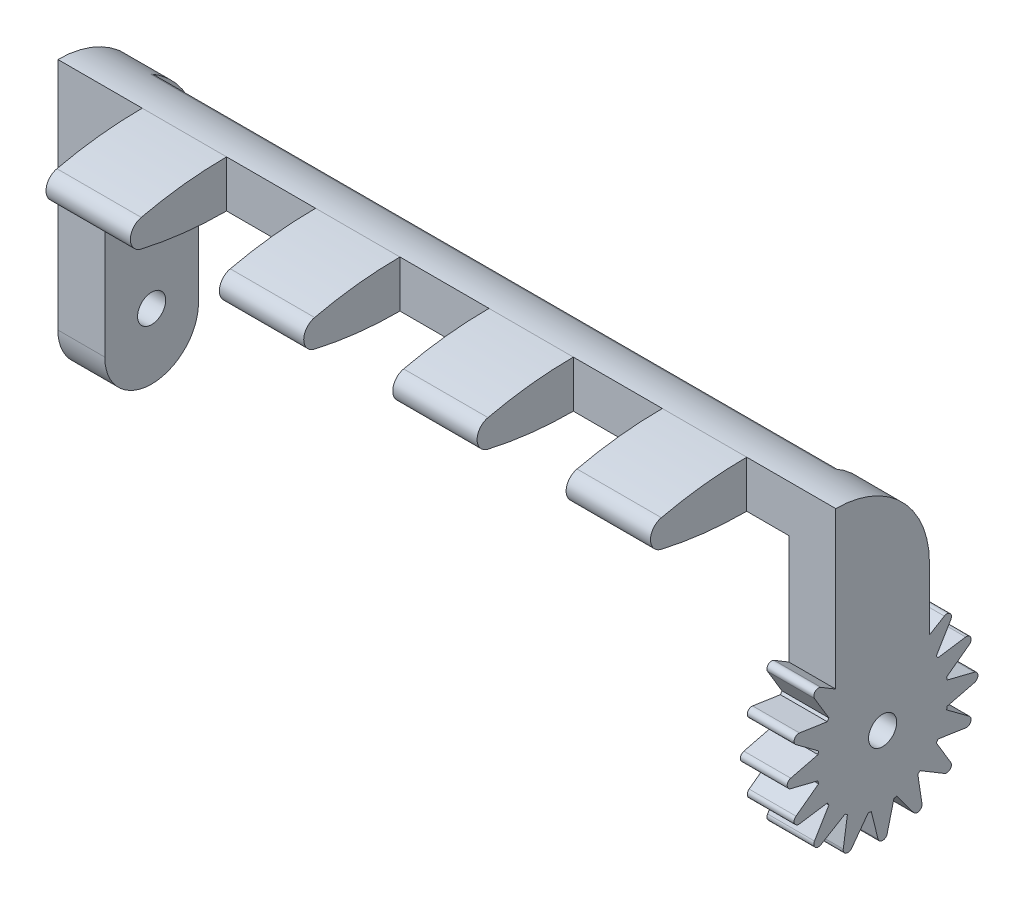
from build123d import *

# Parameters (mm, degrees)
BOSS_EXTRU_1_DEPTH               = 10
BOSS_EXTRU_2_START               = -9
BOSS_EXTRU_2_DEPTH               = 9
CONG_1_R                         = 1.5
R_P_TITION_LIN_AIRE1_COUNT       = 4
R_P_TITION_LIN_AIRE1_PITCH       = 18.5
CONG_1_OF_R_P_TITION_LIN_AIRE1_R = 1.5
ENL_V_MAT_EXTRU_1_DEPTH          = 82.974649073
ENL_V_MAT_EXTRU_1_DEPTH_BACK     = 82.974649073
ESQUISSE4_R                      = 1.5
CONG_2_RADIUS                    = 5
CONG_2_LENGTH                    = 5
CONG_3_RADIUS                    = 5
CONG_3_LENGTH                    = 5
CONG_4_R                         = 10
BOSS_EXTRU_3_START               = 73
ESQUISSE5_R                      = 1.5
BOSS_EXTRU_3_DEPTH               = 5
CONG_7_R                         = 2


with BuildPart() as part:
    # Esquisse1 → Boss.-Extru.1 (new body)
    with BuildSketch(Plane.XY):
        Polygon((-36.5, 10), (36.5, 10), (36.5, -10), (36.5, -15), (41.5, -15), (41.5, 15), (-41.5, 15), (-41.5, -15), (-36.5, -15), (-36.5, -10), align=None)
    extrude(amount=BOSS_EXTRU_1_DEPTH)

    # Esquisse2 → Boss.-Extru.2 (add)
    with BuildSketch(Plane.ZY.offset(41.5).offset(BOSS_EXTRU_2_START)):
        with BuildLine():
            Line((10, 10), (10, 15))
            ThreePointArc((10, 15), (17.110731327, 14.370095429), (24, 12.5))
            ThreePointArc((24, 12.5), (17.110731327, 10.629904571), (10, 10))
        make_face()
    boss_extru_2 = extrude(amount=-BOSS_EXTRU_2_DEPTH)

    # Congé1
    cong_1_edges = [part.edges().sort_by_distance(p)[0] for p in [
        (-28, 12.5, 24),
    ]]
    fillet(cong_1_edges, radius=CONG_1_R)

    # Répétition linéaire1: Boss.-Extru.2 ×4
    with Locations(*[(i * R_P_TITION_LIN_AIRE1_PITCH, 0, 0) for i in range(1, R_P_TITION_LIN_AIRE1_COUNT)]):
        add(boss_extru_2)

    # Congé1 of Répétition linéaire1
    cong_1_of_r_p_tition_lin_aire1_edges = [part.edges().sort_by_distance(p)[0] for p in [
        (-9.5, 12.5, 24),
        (9, 12.5, 24),
        (27.5, 12.5, 24),
    ]]
    fillet(cong_1_of_r_p_tition_lin_aire1_edges, radius=CONG_1_OF_R_P_TITION_LIN_AIRE1_R)

    # Esquisse4 → Enlèv. mat.-Extru.1 (cut, two sides: drawn at the far end of the back side and taken through both)
    with BuildSketch(Plane(origin=(-36.5, 0, 0), x_dir=(0, 0, -1), z_dir=(1, 0, 0)).offset(-ENL_V_MAT_EXTRU_1_DEPTH_BACK)):
        with Locations((-5, -8)):
            Circle(ESQUISSE4_R)
    extrude(amount=ENL_V_MAT_EXTRU_1_DEPTH + ENL_V_MAT_EXTRU_1_DEPTH_BACK, mode=Mode.SUBTRACT)

    # Congé2: full round fillet: the end face becomes a half cylinder, R = half its width
    cong_2_face = Plane((-39, -15, 5), x_dir=(1, 0, 0), z_dir=(0, -1, 0))  # on the end face: x along it, z out of the body
    cong_2_slab = cong_2_face.offset(-CONG_2_RADIUS / 2) * Box(CONG_2_LENGTH, 2 * CONG_2_RADIUS, CONG_2_RADIUS, mode=Mode.PRIVATE)  # the body's end, R deep
    cong_2_round = Plane((-39, -10, 5), x_dir=(0, -1, 0), z_dir=(1, 0, 0)) * Cylinder(CONG_2_RADIUS, CONG_2_LENGTH, mode=Mode.PRIVATE)  # its axis R under the face
    add(cong_2_slab - cong_2_round, mode=Mode.SUBTRACT)

    # Congé3: full round fillet: the end face becomes a half cylinder, R = half its width
    cong_3_face = Plane((39, -15, 5), x_dir=(1, 0, 0), z_dir=(0, -1, 0))  # on the end face: x along it, z out of the body
    cong_3_slab = cong_3_face.offset(-CONG_3_RADIUS / 2) * Box(CONG_3_LENGTH, 2 * CONG_3_RADIUS, CONG_3_RADIUS, mode=Mode.PRIVATE)  # the body's end, R deep
    cong_3_round = Plane((39, -10, 5), x_dir=(0, -1, 0), z_dir=(1, 0, 0)) * Cylinder(CONG_3_RADIUS, CONG_3_LENGTH, mode=Mode.PRIVATE)  # its axis R under the face
    add(cong_3_slab - cong_3_round, mode=Mode.SUBTRACT)

    # Congé4
    # the kernel refuses this fillet: 10 mm, written as the material it takes off along each edge
    with BuildSketch(Plane(origin=(66.5, 15, 0), x_dir=(0, -1, 0), z_dir=(-1, 0, 0))) as cong_4_piece_1:
        with BuildLine():
            CenterArc((CONG_4_R, CONG_4_R), CONG_4_R, 180, 90)
            Line((0, CONG_4_R), (0, 0))
            Line((0, 0), (CONG_4_R, 0))
        make_face()
    extrude(amount=133, mode=Mode.SUBTRACT)

    # Esquisse5 → Boss.-Extru.3 (add)
    with BuildSketch(Plane(origin=(-36.5, 0, 0), x_dir=(0, 0, -1), z_dir=(1, 0, 0)).offset(BOSS_EXTRU_3_START)):
        with BuildLine():
            Line((-14.800353701, -8.485147863), (-11.894696869, -9.209609478))
            ThreePointArc((-11.894696869, -9.209609478), (-11.865496963, -9.365632254), (-11.832766827, -9.520952824))
            Line((-11.832766827, -9.520952824), (-14.240004245, -11.302214812))
            ThreePointArc((-14.240004245, -11.302214812), (-14.404532618, -11.895484958), (-13.868688146, -12.198651174))
            Line((-13.868688146, -12.198651174), (-10.906971813, -11.756019702))
            ThreePointArc((-10.906971813, -11.756019702), (-10.820287286, -11.888991631), (-10.730609975, -12.019963846))
            Line((-10.730609975, -12.019963846), (-12.272947904, -14.586845216))
            ThreePointArc((-12.272947904, -14.586845216), (-12.197917644, -15.197917644), (-11.586845216, -15.272947904))
            Line((-11.586845216, -15.272947904), (-9.019963846, -13.730609975))
            ThreePointArc((-9.019963846, -13.730609975), (-8.888991631, -13.820287286), (-8.756019702, -13.906971813))
            Line((-8.756019702, -13.906971813), (-9.198651174, -16.868688146))
            ThreePointArc((-9.198651174, -16.868688146), (-8.895484958, -17.404532618), (-8.302214812, -17.240004245))
            Line((-8.302214812, -17.240004245), (-6.520952824, -14.832766827))
            ThreePointArc((-6.520952824, -14.832766827), (-6.365632254, -14.865496963), (-6.209609478, -14.894696869))
            Line((-6.209609478, -14.894696869), (-5.485147863, -17.800353701))
            ThreePointArc((-5.485147863, -17.800353701), (-5, -18.179392753), (-4.514852137, -17.800353701))
            Line((-4.514852137, -17.800353701), (-3.790390522, -14.894696869))
            ThreePointArc((-3.790390522, -14.894696869), (-3.634367746, -14.865496963), (-3.479047176, -14.832766827))
            Line((-3.479047176, -14.832766827), (-1.697785188, -17.240004245))
            ThreePointArc((-1.697785188, -17.240004245), (-1.104515042, -17.404532618), (-0.801348826, -16.868688146))
            Line((-0.801348826, -16.868688146), (-1.243980298, -13.906971813))
            ThreePointArc((-1.243980298, -13.906971813), (-1.111008369, -13.820287286), (-0.980036154, -13.730609975))
            Line((-0.980036154, -13.730609975), (1.586845216, -15.272947904))
            ThreePointArc((1.586845216, -15.272947904), (2.197917644, -15.197917644), (2.272947904, -14.586845216))
            Line((2.272947904, -14.586845216), (0.730609975, -12.019963846))
            ThreePointArc((0.730609975, -12.019963846), (0.820287286, -11.888991631), (0.906971813, -11.756019702))
            Line((0.906971813, -11.756019702), (3.868688146, -12.198651174))
            ThreePointArc((3.868688146, -12.198651174), (4.404532618, -11.895484958), (4.240004245, -11.302214812))
            Line((4.240004245, -11.302214812), (1.832766827, -9.520952824))
            ThreePointArc((1.832766827, -9.520952824), (1.865496963, -9.365632254), (1.894696869, -9.209609478))
            Line((1.894696869, -9.209609478), (4.800353701, -8.485147863))
            ThreePointArc((4.800353701, -8.485147863), (5.179392753, -8), (4.800353701, -7.514852137))
            Line((4.800353701, -7.514852137), (1.894696869, -6.790390522))
            ThreePointArc((1.894696869, -6.790390522), (1.865496963, -6.634367746), (1.832766827, -6.479047176))
            Line((1.832766827, -6.479047176), (4.240004245, -4.697785188))
            ThreePointArc((4.240004245, -4.697785188), (4.404532618, -4.104515042), (3.868688146, -3.801348826))
            Line((3.868688146, -3.801348826), (0.906971813, -4.243980298))
            ThreePointArc((0.906971813, -4.243980298), (0.820287286, -4.111008369), (0.730609975, -3.980036154))
            Line((0.730609975, -3.980036154), (2.272947904, -1.413154784))
            ThreePointArc((2.272947904, -1.413154784), (2.197917644, -0.802082356), (1.586845216, -0.727052096))
            Line((1.586845216, -0.727052096), (-0.980036154, -2.269390025))
            ThreePointArc((-0.980036154, -2.269390025), (-1.111008369, -2.179712714), (-1.243980298, -2.093028187))
            Line((-1.243980298, -2.093028187), (-0.801348826, 0.868688146))
            ThreePointArc((-0.801348826, 0.868688146), (-1.104515042, 1.404532618), (-1.697785188, 1.240004245))
            Line((-1.697785188, 1.240004245), (-3.479047176, -1.167233173))
            ThreePointArc((-3.479047176, -1.167233173), (-3.634367746, -1.134503037), (-3.790390522, -1.105303131))
            Line((-3.790390522, -1.105303131), (-4.514852137, 1.800353701))
            ThreePointArc((-4.514852137, 1.800353701), (-5, 2.179392753), (-5.485147863, 1.800353701))
            Line((-5.485147863, 1.800353701), (-6.209609478, -1.105303131))
            ThreePointArc((-6.209609478, -1.105303131), (-6.365632254, -1.134503037), (-6.520952824, -1.167233173))
            Line((-6.520952824, -1.167233173), (-8.302214812, 1.240004245))
            ThreePointArc((-8.302214812, 1.240004245), (-8.895484958, 1.404532618), (-9.198651174, 0.868688146))
            Line((-9.198651174, 0.868688146), (-8.756019702, -2.093028187))
            ThreePointArc((-8.756019702, -2.093028187), (-8.888991631, -2.179712714), (-9.019963846, -2.269390025))
            Line((-9.019963846, -2.269390025), (-11.586845216, -0.727052096))
            ThreePointArc((-11.586845216, -0.727052096), (-12.197917644, -0.802082356), (-12.272947904, -1.413154784))
            Line((-12.272947904, -1.413154784), (-10.730609975, -3.980036154))
            ThreePointArc((-10.730609975, -3.980036154), (-10.820287286, -4.111008369), (-10.906971813, -4.243980298))
            Line((-10.906971813, -4.243980298), (-13.868688146, -3.801348826))
            ThreePointArc((-13.868688146, -3.801348826), (-14.404532618, -4.104515042), (-14.240004245, -4.697785188))
            Line((-14.240004245, -4.697785188), (-11.832766827, -6.479047176))
            ThreePointArc((-11.832766827, -6.479047176), (-11.865496963, -6.634367746), (-11.894696869, -6.790390522))
            Line((-11.894696869, -6.790390522), (-14.800353701, -7.514852137))
            ThreePointArc((-14.800353701, -7.514852137), (-15.179392753, -8), (-14.800353701, -8.485147863))
        make_face()
        with Locations((-5, -8)):
            Circle(ESQUISSE5_R, mode=Mode.SUBTRACT)
    extrude(amount=BOSS_EXTRU_3_DEPTH)

    # Congé7
    cong_7_edges = [part.edges().sort_by_distance(p)[0] for p in [
        (0, 10, 1.339745962),
    ]]
    fillet(cong_7_edges, radius=CONG_7_R)


solid = part.part
